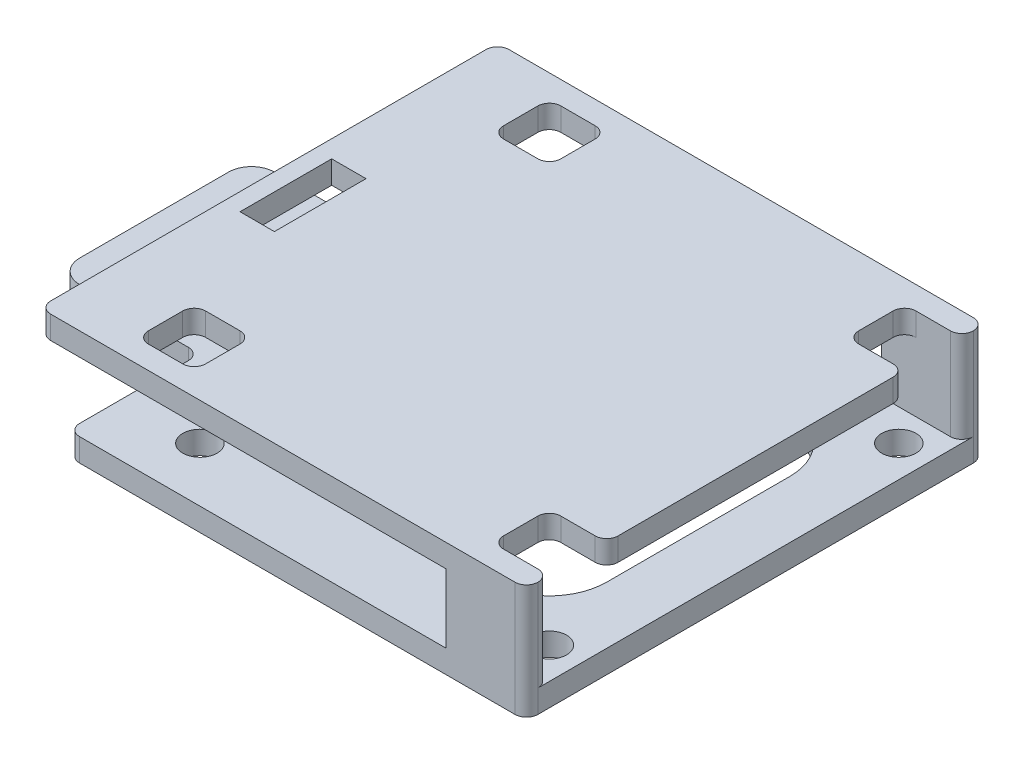
from build123d import *

# Parameters (mm, degrees)
CROQUIS1_W              = 16.5
CROQUIS1_H              = 17
CROQUIS1_R              = 1.5
CROQUIS1_W_2            = 5
SALIENTE_EXTRUIR1_DEPTH = 2
SALIENTE_EXTRUIR2_DEPTH = 2
CROQUIS4_W              = 7
CROQUIS4_H              = 2
SALIENTE_EXTRUIR3_DEPTH = 6
CROQUIS7_W              = 42.522469992
CROQUIS7_H              = 40
SALIENTE_EXTRUIR5_DEPTH = 2
CORTAR_EXTRUIR1_REACH   = 43.113
CROQUIS8_W              = 5
CROQUIS8_H              = 5
REDONDEO1_R             = 5
REDONDEO2_R             = 2
CORTAR_EXTRUIR3_REACH   = 43.113
CROQUIS12_W             = 3
CROQUIS12_H             = 8
REDONDEO3_R             = 1


with BuildPart() as part:
    # Croquis1 → Saliente-Extruir1 (new body)
    # profile 1 of 3: a face of its own
    with BuildSketch(Plane(origin=(0, 0, 0), x_dir=(1, 0, 0), z_dir=(0, 1, 0))):
        with Locations((-26.25, 0)):
            Rectangle(CROQUIS1_W, CROQUIS1_H)
    # profile 2 of 3: a face of its own
    with BuildSketch(Plane(origin=(0, 0, 0), x_dir=(1, 0, 0), z_dir=(0, 1, 0))):
        Polygon((13, -13), (-13, -13), (-13, -8.5), (-18, -8.5), (-18, -18), (18, -18), (18, 18), (-18, 18), (-18, 8.5), (-13, 8.5), (-13, 13), (13, 13), align=None)
        with Locations(Location((-15.25, -15.25, 0), (0, 0, 270))):
            Circle(CROQUIS1_R, mode=Mode.SUBTRACT)
        with Locations(Location((15.25, -15.25, 0), (0, 0, 270))):
            Circle(CROQUIS1_R, mode=Mode.SUBTRACT)
        with Locations(Location((-15.25, 15.25, 0), (0, 0, 270))):
            Circle(CROQUIS1_R, mode=Mode.SUBTRACT)
        with Locations(Location((15.25, 15.25, 0), (0, 0, 270))):
            Circle(CROQUIS1_R, mode=Mode.SUBTRACT)
    # profile 3 of 3: a face of its own
    with BuildSketch(Plane(origin=(0, 0, 0), x_dir=(1, 0, 0), z_dir=(0, 1, 0))):
        with Locations((-15.5, 0)):
            Rectangle(CROQUIS1_W_2, CROQUIS1_H)
    extrude(amount=SALIENTE_EXTRUIR1_DEPTH)

    # Croquis2 → Saliente-Extruir2 (add)
    with BuildSketch(Plane(origin=(0, 2, 0), x_dir=(1, 0, 0), z_dir=(0, 1, 0))):
        Polygon((18, 18), (18, 20), (-22, 20), (-22, 8.5), (-18, 8.5), (-18, 18), align=None)
        Polygon((18, -20), (18, -18), (-18, -18), (-18, -8.5), (-22, -8.5), (-22, -20), align=None)
    extrude(amount=-SALIENTE_EXTRUIR2_DEPTH)

    # Croquis4 → Saliente-Extruir3 (add)
    with BuildSketch(Plane(origin=(0, 2, 0), x_dir=(1, 0, 0), z_dir=(0, 1, 0))):
        with Locations((14.5, -19)):
            Rectangle(CROQUIS4_W, CROQUIS4_H)
        with Locations((14.5, 19)):
            Rectangle(CROQUIS4_W, CROQUIS4_H)
    extrude(amount=SALIENTE_EXTRUIR3_DEPTH)

    # Croquis7 → Saliente-Extruir5 (add)
    with BuildSketch(Plane(origin=(0, 8, 0), x_dir=(1, 0, 0), z_dir=(0, 1, 0))):
        with Locations((-3.261234996, 0)):
            Rectangle(CROQUIS7_W, CROQUIS7_H)
    extrude(amount=SALIENTE_EXTRUIR5_DEPTH)

    # Croquis8 → Cortar-Extruir1 (cut, up to next)
    with BuildSketch(Plane(origin=(0, 10, 0), x_dir=(1, 0, 0), z_dir=(0, 1, 0)), mode=Mode.PRIVATE) as cortar_extruir1_sk1:
        with Locations((15.5, -15.5)):
            Rectangle(CROQUIS8_W, CROQUIS8_H)
    cortar_extruir1_tool1 = extrude(cortar_extruir1_sk1.sketch, amount=-CORTAR_EXTRUIR1_REACH, mode=Mode.PRIVATE) & part.part
    # Croquis8 → Cortar-Extruir1 (cut, up to next)
    with BuildSketch(Plane(origin=(0, 10, 0), x_dir=(1, 0, 0), z_dir=(0, 1, 0)), mode=Mode.PRIVATE) as cortar_extruir1_sk2:
        with Locations((15.5, 15.5)):
            Rectangle(CROQUIS8_W, CROQUIS8_H)
    cortar_extruir1_tool2 = extrude(cortar_extruir1_sk2.sketch, amount=-CORTAR_EXTRUIR1_REACH, mode=Mode.PRIVATE) & part.part
    # Croquis8 → Cortar-Extruir1 (cut, up to next)
    with BuildSketch(Plane(origin=(0, 10, 0), x_dir=(1, 0, 0), z_dir=(0, 1, 0)), mode=Mode.PRIVATE) as cortar_extruir1_sk3:
        with Locations((-15.5, 15.5)):
            Rectangle(CROQUIS8_W, CROQUIS8_H)
    cortar_extruir1_tool3 = extrude(cortar_extruir1_sk3.sketch, amount=-CORTAR_EXTRUIR1_REACH, mode=Mode.PRIVATE) & part.part
    # Croquis8 → Cortar-Extruir1 (cut, up to next)
    with BuildSketch(Plane(origin=(0, 10, 0), x_dir=(1, 0, 0), z_dir=(0, 1, 0)), mode=Mode.PRIVATE) as cortar_extruir1_sk4:
        with Locations((-15.5, -15.5)):
            Rectangle(CROQUIS8_W, CROQUIS8_H)
    cortar_extruir1_tool4 = extrude(cortar_extruir1_sk4.sketch, amount=-CORTAR_EXTRUIR1_REACH, mode=Mode.PRIVATE) & part.part
    add(cortar_extruir1_tool1.solids().sort_by_distance((15.5, 10, 15.5))[0], mode=Mode.SUBTRACT)
    add(cortar_extruir1_tool2.solids().sort_by_distance((15.5, 10, -15.5))[0], mode=Mode.SUBTRACT)
    add(cortar_extruir1_tool3.solids().sort_by_distance((-15.5, 10, -15.5))[0], mode=Mode.SUBTRACT)
    add(cortar_extruir1_tool4.solids().sort_by_distance((-15.5, 10, 15.5))[0], mode=Mode.SUBTRACT)

    # Redondeo1
    redondeo1_edges = [part.edges().sort_by_distance(p)[0] for p in [
        (-13, 1, 13),
        (13, 1, 13),
        (13, 1, -13),
        (-13, 1, -13),
    ]]
    fillet(redondeo1_edges, radius=REDONDEO1_R)

    # Redondeo2
    redondeo2_edges = [part.edges().sort_by_distance(p)[0] for p in [
        (-34.5, 1, 8.5),
        (-34.5, 1, -8.5),
    ]]
    fillet(redondeo2_edges, radius=REDONDEO2_R)

    # Croquis12 → Cortar-Extruir3 (cut, up to next)
    with BuildSketch(Plane(origin=(0, 10, 0), x_dir=(1, 0, 0), z_dir=(0, 1, 0)), mode=Mode.PRIVATE) as cortar_extruir3_sk1:
        with Locations((-21.5, 0)):
            Rectangle(CROQUIS12_W, CROQUIS12_H)
    cortar_extruir3_tool1 = extrude(cortar_extruir3_sk1.sketch, amount=-CORTAR_EXTRUIR3_REACH, mode=Mode.PRIVATE) & part.part
    add(cortar_extruir3_tool1.solids().sort_by_distance((-21.5, 10, 0))[0], mode=Mode.SUBTRACT)

    # Redondeo3
    redondeo3_edges = [part.edges().sort_by_distance(p)[0] for p in [
        (-24.522469992, 9, -20),
        (-24.522469992, 9, 20),
        (-18, 9, 13),
        (-18, 9, 18),
        (-13, 9, 18),
        (-13, 9, 13),
        (-18, 9, -18),
        (-18, 9, -13),
        (-13, 9, -13),
        (-13, 9, -18),
        (18, 9, -13),
        (13, 9, -18),
        (13, 9, -13),
        (13, 9, 13),
        (13, 9, 18),
        (18, 9, 13),
        (-22, 1, -8.5),
        (18, 5, -20),
        (-22, 1, -20),
        (18, 5, 20),
        (-22, 1, 8.5),
        (-22, 1, 20),
        (18, 6, 18),
        (18, 6, -18),
    ]]
    fillet(redondeo3_edges, radius=REDONDEO3_R - 0.0001)  # a hair under: the kernel refuses the full size


solid = part.part
